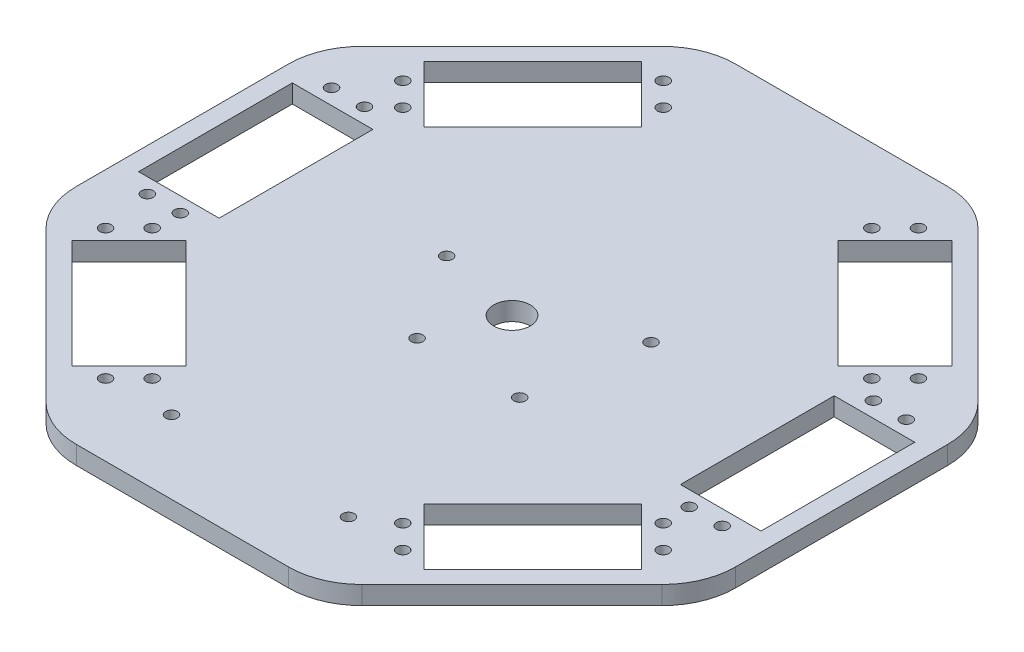
from build123d import *

# Parameters (mm, degrees)
BASEPLATE_DEPTH           = 5
FILLET1_R                 = 20
SKETCH2_W                 = 22
SKETCH2_H                 = 42
SKETCH2_R                 = 1.6
SERVO_HOLE_DEPTH          = 128.377392029
SKETCH3_R                 = 5
CENTER_HOLE_DEPTH         = 128.377392029
SERVO_HOLE_PATTERN_COUNT  = 8
SKETCH4_R                 = 1.6
ARDUINO_SCREW_HOLES_DEPTH = 128.377392029
MIRROR1_COPY_1_SKETCH_W   = 22
MIRROR1_COPY_1_SKETCH_H   = 42
MIRROR1_COPY_1_SKETCH_R   = 1.6
MIRROR1_COPY_1_DEPTH      = 128.377392029
MIRROR1_COPY_2_SKETCH_W   = 22
MIRROR1_COPY_2_SKETCH_H   = 42
MIRROR1_COPY_2_SKETCH_R   = 1.6
MIRROR1_COPY_2_DEPTH      = 128.377392029


with BuildPart() as part:
    # Sketch1 → Baseplate (new body)
    with BuildSketch(Plane(origin=(0, 0, 0), x_dir=(1, 0, 0), z_dir=(0, 1, 0))):
        Polygon((-90, 37.279220614), (-90, -37.279220614), (-37.279220614, -90), (37.279220614, -90), (90, -37.279220614), (90, 37.279220614), (37.279220614, 90), (-37.279220614, 90), align=None)
    extrude(amount=BASEPLATE_DEPTH)

    # Fillet1
    fillet1_edges = [part.edges().sort_by_distance(p)[0] for p in [
        (-90, 2.5, -37.279220614),
        (-37.279220614, 2.5, -90),
        (37.279220614, 2.5, -90),
        (90, 2.5, -37.279220614),
        (90, 2.5, 37.279220614),
        (37.279220614, 2.5, 90),
        (-37.279220614, 2.5, 90),
        (-90, 2.5, 37.279220614),
    ]]
    fillet(fillet1_edges, radius=FILLET1_R)

    # Sketch2 → Servo hole (cut, through all)
    with BuildSketch(Plane(origin=(0, 5, 0), x_dir=(1, 0, 0), z_dir=(0, 1, 0))):
        with Locations((74, 4.005050634)):
            Rectangle(SKETCH2_W, SKETCH2_H)
        with Locations((78.5, 29.205050634)):
            Circle(SKETCH2_R)
        with Locations((69.5, 29.205050634)):
            Circle(SKETCH2_R)
        with Locations((69.5, -21.094949366)):
            Circle(SKETCH2_R)
        with Locations((78.5, -21.094949366)):
            Circle(SKETCH2_R)
    servo_hole = extrude(amount=-SERVO_HOLE_DEPTH, mode=Mode.SUBTRACT)

    # Sketch3 → Center hole (cut, through all)
    with BuildSketch(Plane(origin=(0, 5, 0), x_dir=(1, 0, 0), z_dir=(0, 1, 0))):
        Circle(SKETCH3_R)
    extrude(amount=-CENTER_HOLE_DEPTH, mode=Mode.SUBTRACT)

    # Servo hole pattern: Servo hole ×8 about axis, 5 skipped
    servo_hole_pattern_axis = Axis((0, 5, 0), (0, 1, 0))
    add([servo_hole.rotate(servo_hole_pattern_axis, i * 360 / SERVO_HOLE_PATTERN_COUNT) for i in range(1, SERVO_HOLE_PATTERN_COUNT) if i not in (2, 3, 4, 5, 6)], mode=Mode.SUBTRACT)

    # Sketch4 → Arduino Screw holes (cut, through all)
    with BuildSketch(Plane(origin=(0, 5, 0), x_dir=(1, 0, 0), z_dir=(0, 1, 0))):
        with Locations((-23, 5.1332)):
            Circle(SKETCH4_R)
        with Locations((-23, -70)):
            Circle(SKETCH4_R)
        with Locations((25.3362, 12.6262)):
            Circle(SKETCH4_R)
        with Locations((25.3362, -70)):
            Circle(SKETCH4_R)
        with Locations((-7.55849277, -18.3745)):
            Circle(SKETCH4_R)
        with Locations((20.45770723, -18.3745)):
            Circle(SKETCH4_R)
    extrude(amount=-ARDUINO_SCREW_HOLES_DEPTH, mode=Mode.SUBTRACT)

    # Mirror1: Servo hole across plane
    add(servo_hole.mirror(Plane(origin=(0, 0, 0), x_dir=(0, 0, 1), z_dir=(1, 0, 0))), mode=Mode.SUBTRACT)

    # Mirror1 copy 1 sketch → Mirror1 copy 1 (cut, through all)
    with BuildSketch(Plane(origin=(0, 5, 0), x_dir=(-0.7071067811865476, 0, -0.7071067811865475), z_dir=(0, 1, 0))):
        with Locations((74, -4.005050634)):
            Rectangle(MIRROR1_COPY_1_SKETCH_W, MIRROR1_COPY_1_SKETCH_H)
        with Locations((78.5, -29.205050634)):
            Circle(MIRROR1_COPY_1_SKETCH_R)
        with Locations((69.5, -29.205050634)):
            Circle(MIRROR1_COPY_1_SKETCH_R)
        with Locations((69.5, 21.094949366)):
            Circle(MIRROR1_COPY_1_SKETCH_R)
        with Locations((78.5, 21.094949366)):
            Circle(MIRROR1_COPY_1_SKETCH_R)
    extrude(amount=-MIRROR1_COPY_1_DEPTH, mode=Mode.SUBTRACT)

    # Mirror1 copy 2 sketch → Mirror1 copy 2 (cut, through all)
    with BuildSketch(Plane(origin=(0, 5, 0), x_dir=(-0.7071067811865474, 0, 0.7071067811865477), z_dir=(0, 1, 0))):
        with Locations((74, -4.005050634)):
            Rectangle(MIRROR1_COPY_2_SKETCH_W, MIRROR1_COPY_2_SKETCH_H)
        with Locations((78.5, -29.205050634)):
            Circle(MIRROR1_COPY_2_SKETCH_R)
        with Locations((69.5, -29.205050634)):
            Circle(MIRROR1_COPY_2_SKETCH_R)
        with Locations((69.5, 21.094949366)):
            Circle(MIRROR1_COPY_2_SKETCH_R)
        with Locations((78.5, 21.094949366)):
            Circle(MIRROR1_COPY_2_SKETCH_R)
    extrude(amount=-MIRROR1_COPY_2_DEPTH, mode=Mode.SUBTRACT)


solid = part.part
